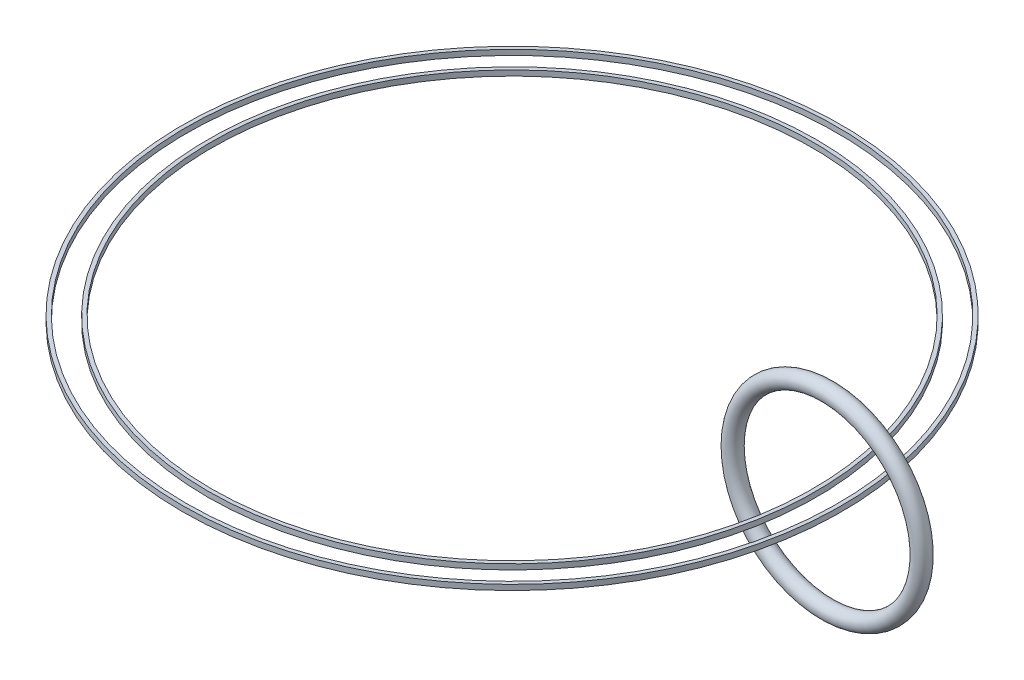
from build123d import *

# Parameters (mm, degrees)
SKETCH_1_R            = 260
SKETCH_1_R_2          = 250
REVOLVE_2_OUTLINE_W   = 120
REVOLVE_2_OUTLINE_H   = 170
REVOLVE_2_OUTLINE_W_2 = 100
REVOLVE_2_OUTLINE_H_2 = 150


# Read off the part's stored shape, not the designer's step: 旋转-薄壁2
with BuildPart() as part:
    # 草图1 → 旋转-薄壁1 (revolve)
    with BuildSketch(Plane(origin=(0, 0, 0), x_dir=(1, 0, 0), z_dir=(0, 1, 0)), mode=Mode.PRIVATE) as revolve_1_sk:
        Circle(SKETCH_1_R)
        Circle(SKETCH_1_R_2, mode=Mode.SUBTRACT)
    revolve(revolve_1_sk.sketch.rotate(Axis((-3000, 0, -270.869049162), (0, 0, 1)), 180), axis=Axis((-3000, 0, -270.869049162), (0, 0, 1)))


with BuildPart() as body_2:
    # 旋转-薄壁2 outline → 旋转-薄壁2 (revolve)
    # profile 1 of 2: a face of its own
    with BuildSketch(Plane(origin=(-13000, 0, 0), x_dir=(1, 0, 0), z_dir=(0, 0, 1))):
        with Locations((10400, 0)):
            Rectangle(REVOLVE_2_OUTLINE_W, REVOLVE_2_OUTLINE_H)
        with Locations((10400, 0)):
            Rectangle(REVOLVE_2_OUTLINE_W_2, REVOLVE_2_OUTLINE_H_2, mode=Mode.SUBTRACT)
    # profile 2 of 2: a face of its own
    with BuildSketch(Plane(origin=(-13000, 0, 0), x_dir=(1, 0, 0), z_dir=(0, 0, 1))):
        with Locations((9600, 0)):
            Rectangle(REVOLVE_2_OUTLINE_W, REVOLVE_2_OUTLINE_H)
        with Locations((9600, 0)):
            Rectangle(REVOLVE_2_OUTLINE_W_2, REVOLVE_2_OUTLINE_H_2, mode=Mode.SUBTRACT)
    revolve(axis=Axis((-13000, 0, 0), (0, 1, 0)))


solid = Compound([part.part, body_2.part])
